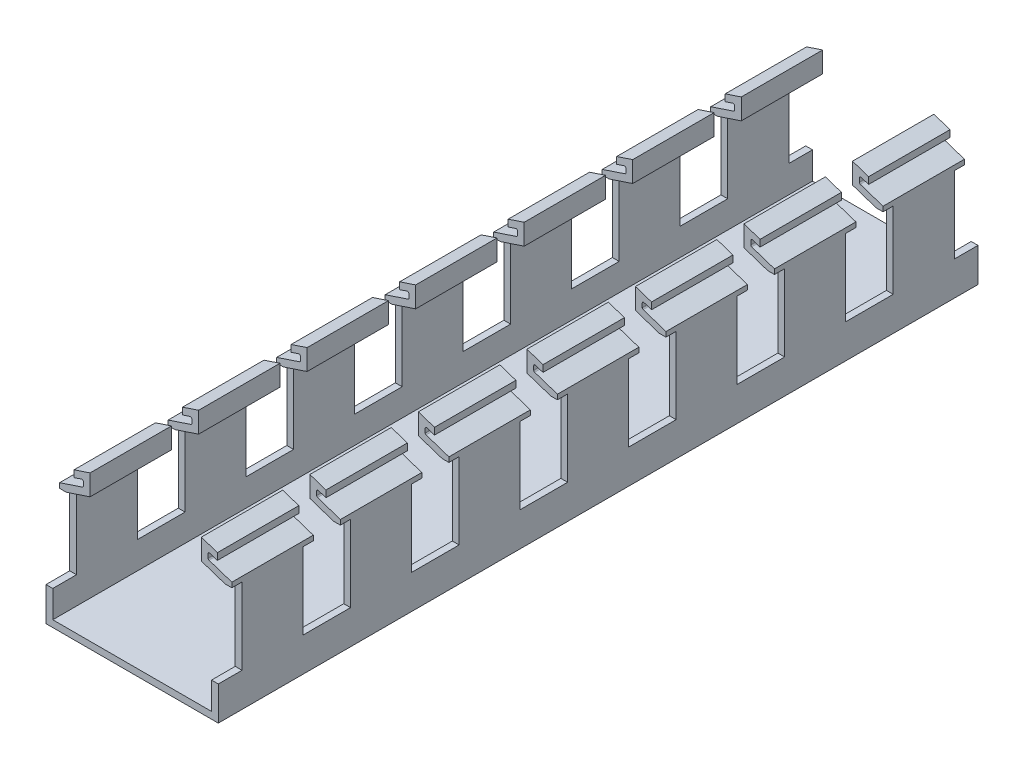
from build123d import *

# Parameters (mm, degrees)
SALIENTE_EXTRUIR1_DEPTH = 8
CORTAR_EXTRUIR1_DEPTH   = 33
MATRIZL1_COUNT          = 7
MATRIZL1_PITCH          = 16


with BuildPart() as part:
    # Croquis2 → Saliente-Extruir1 (new, symmetric)
    with BuildSketch(Plane.XY):
        with BuildLine():
            Line((-12.7, 0), (12.7, 0))
            Line((12.7, 0), (12.7, 17))
            Line((12.7, 17), (9.336754447, 18.121081851))
            ThreePointArc((9.336754447, 18.121081851), (9.237751563, 18.193876454), (9.2, 18.310818511))
            Line((9.2, 18.310818511), (9.2, 18.889181489))
            ThreePointArc((9.2, 18.889181489), (9.283057943, 19.051429926), (9.463245553, 19.078918149))
            Line((9.463245553, 19.078918149), (10.571708245, 18.709430585))
            Line((10.571708245, 18.709430585), (10.571708245, 19.709430585))
            Line((10.571708245, 19.709430585), (8.2, 20.5))
            Line((8.2, 20.5), (8.2, 17.445907447))
            Line((8.2, 17.445907447), (11.7, 16.27924078))
            Line((11.7, 16.27924078), (11.7, 1))
            Line((11.7, 1), (-11.7, 1))
            Line((-11.7, 1), (-11.7, 16.27924078))
            Line((-11.7, 16.27924078), (-8.2, 17.445907447))
            Line((-8.2, 17.445907447), (-8.2, 20.5))
            Line((-8.2, 20.5), (-10.571708245, 19.709430585))
            Line((-10.571708245, 19.709430585), (-10.571708245, 18.709430585))
            Line((-10.571708245, 18.709430585), (-9.463245553, 19.078918149))
            ThreePointArc((-9.463245553, 19.078918149), (-9.283057943, 19.051429926), (-9.2, 18.889181489))
            Line((-9.2, 18.889181489), (-9.2, 18.310818511))
            ThreePointArc((-9.2, 18.310818511), (-9.237751563, 18.193876454), (-9.336754447, 18.121081851))
            Line((-9.336754447, 18.121081851), (-12.7, 17))
            Line((-12.7, 17), (-12.7, 0))
        make_face()
    saliente_extruir1 = extrude(amount=SALIENTE_EXTRUIR1_DEPTH, both=True)

    # Croquis3 → Cortar-Extruir1 (cut, symmetric)
    with BuildSketch(Plane(origin=(0, 0, 0), x_dir=(0, 0, -1), z_dir=(1, 0, 0))):
        Polygon((-8, 5), (-4.5, 5), (-4.5, 16.27924078), (-6, 16.27924078), (-6, 20.5), (-8, 20.5), align=None)
        Polygon((8, 20.5), (6, 20.5), (6, 16.27924078), (4.5, 16.27924078), (4.5, 5), (8, 5), align=None)
    cortar_extruir1 = extrude(amount=CORTAR_EXTRUIR1_DEPTH, both=True, mode=Mode.SUBTRACT)

    # MatrizL1: Saliente-Extruir1, Cortar-Extruir1 ×7
    with Locations(*[(0, 0, -i * MATRIZL1_PITCH) for i in range(1, MATRIZL1_COUNT)]):
        add(saliente_extruir1)
        add(cortar_extruir1, mode=Mode.SUBTRACT)


solid = part.part
